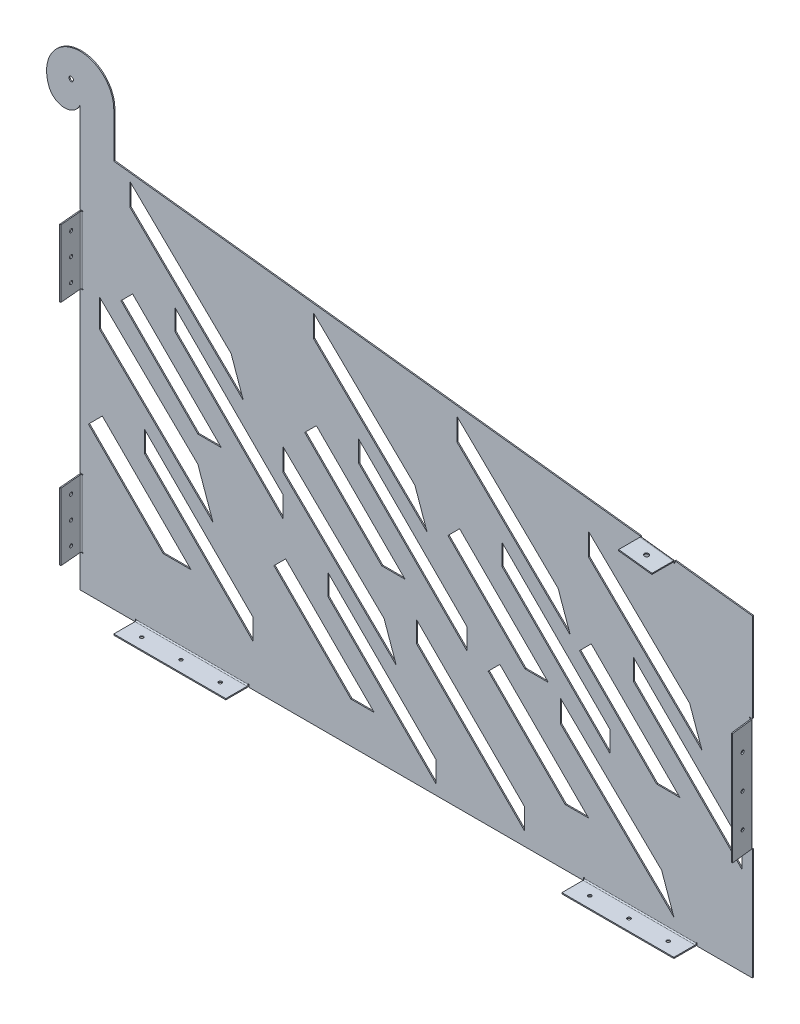
from build123d import *

# Parameters (mm, degrees)
BASE_FLANGE1_DEPTH            = 1
EDGE_FLANGE1_STRIP_W          = 6
EDGE_FLANGE1_STRIP_H          = 1
EDGE_FLANGE1_STRIP_CUT_DEPTH  = 100
EDGE_FLANGE1_RELIEF_W         = 6.5
EDGE_FLANGE1_RELIEF_H         = 0.5
EDGE_FLANGE1_RELIEF_CUT_DEPTH = 1
EDGE_FLANGE1_DEPTH            = 100
EDGE_FLANGE1_PROFILE_W        = 100
EDGE_FLANGE1_PROFILE_H        = 19
EDGE_FLANGE1_PROFILE_R        = 1.5
EDGE_FLANGE1_FLAT_DEPTH       = 1
EDGE_FLANGE2_START            = 29.5
EDGE_FLANGE2_DEPTH            = 61
EDGE_FLANGE2_2_DEPTH          = 0.5
EDGE_FLANGE2_START_2          = 90
EDGE_FLANGE2_3_DEPTH          = 0.5
EDGE_FLANGE2_START_3          = 30
EDGE_FLANGE2_4_DEPTH          = 60
EDGE_FLANGE2_5_OUTLINE_R      = 1.5
EDGE_FLANGE2_5_DEPTH          = 1
CUT_EXTRUDE12_DEPTH           = 10
CUT_EXTRUDE13_DEPTH           = 10
SKETCH44_R                    = 2
CUT_EXTRUDE14_DEPTH           = 10
EDGE_FLANGE3_START            = 99.5
EDGE_FLANGE3_DEPTH            = 101
EDGE_FLANGE3_2_DEPTH          = 0.5
EDGE_FLANGE3_START_2          = 200
EDGE_FLANGE3_3_DEPTH          = 0.5
EDGE_FLANGE3_START_3          = 100
EDGE_FLANGE3_4_DEPTH          = 100
EDGE_FLANGE3_START_4          = 595.083613355
EDGE_FLANGE3_5_OUTLINE_R      = 1.5
EDGE_FLANGE3_5_DEPTH          = 1
EDGE_FLANGE4_STRIP_W          = 6
EDGE_FLANGE4_STRIP_H          = 1
EDGE_FLANGE4_STRIP_CUT_DEPTH  = 30
EDGE_FLANGE4_RELIEF_W         = 6.5
EDGE_FLANGE4_RELIEF_H         = 0.5
EDGE_FLANGE4_RELIEF_CUT_DEPTH = 1
EDGE_FLANGE4_DEPTH            = 30
EDGE_FLANGE4_PROFILE_W        = 30
EDGE_FLANGE4_PROFILE_H        = 19
EDGE_FLANGE4_PROFILE_R        = 2
EDGE_FLANGE4_FLAT_DEPTH       = 1


with BuildPart() as part:
    # Base-Flange1: sheet metal written as solids
    # Sketch1 → Base-Flange1 (new body)
    with BuildSketch(Plane.XY):
        with BuildLine():
            Line((0, 0), (0, 350))
            Line((0, 350), (0, 375))
            ThreePointArc((0, 375), (-13.854151002, 365.75), (-27.708302005, 375))
            ThreePointArc((-27.708302005, 375), (-5.863059775, 415.921497754), (30, 386.5))
            Line((30, 386.5), (30, 346.5))
            Line((30, 346.5), (600, 280))
            Line((600, 280), (600, 0))
            Line((600, 0), (0, 0))
        make_face()
    extrude(amount=-BASE_FLANGE1_DEPTH)

    # Edge-Flange1: sheet metal written as solids
    # Edge-Flange1 strip (on a plane across the edge) → Edge-Flange1 strip cut (cut)
    with BuildSketch(Plane.YZ.offset(450)):
        with Locations((-1, -0.5)):
            Rectangle(EDGE_FLANGE1_STRIP_W, EDGE_FLANGE1_STRIP_H)
    edge_flange1_strip_cut = extrude(amount=EDGE_FLANGE1_STRIP_CUT_DEPTH, mode=Mode.SUBTRACT)

    # Edge-Flange1 relief (on the sheet) → Edge-Flange1 relief cut (cut)
    with BuildSketch(Plane(origin=(450, 2, 0), x_dir=(0, 1, 0), z_dir=(0, 0, 1))):
        with Locations((-2.75, 0.25)):
            Rectangle(EDGE_FLANGE1_RELIEF_W, EDGE_FLANGE1_RELIEF_H)
        with Locations((-2.75, -100.25)):
            Rectangle(EDGE_FLANGE1_RELIEF_W, EDGE_FLANGE1_RELIEF_H)
    edge_flange1_relief_cut = extrude(amount=-EDGE_FLANGE1_RELIEF_CUT_DEPTH, mode=Mode.SUBTRACT)

    # Edge-Flange1 bend section (on a plane across the edge) → Edge-Flange1 (add)
    with BuildSketch(Plane.YZ.offset(450)):
        with BuildLine():
            Line((0, 1), (1, 1))
            ThreePointArc((1, 1), (1.292893219, 0.292893219), (2, 0))
            Line((2, 0), (2, -1))
            ThreePointArc((2, -1), (0.585786438, -0.414213562), (0, 1))
        make_face()
    edge_flange1 = extrude(amount=EDGE_FLANGE1_DEPTH)

    # Edge-Flange1 profile (on flange) → Edge-Flange1 flat (add)
    with BuildSketch(Plane(origin=(0, 0, 0), x_dir=(-1, 0, 0), z_dir=(0, 1, 0))):
        with Locations((-500, 10.5)):
            Rectangle(EDGE_FLANGE1_PROFILE_W, EDGE_FLANGE1_PROFILE_H)
        with Locations((-535, 10)):
            Circle(EDGE_FLANGE1_PROFILE_R, mode=Mode.SUBTRACT)
        with Locations((-465, 10)):
            Circle(EDGE_FLANGE1_PROFILE_R, mode=Mode.SUBTRACT)
        with Locations((-500, 10)):
            Circle(EDGE_FLANGE1_PROFILE_R, mode=Mode.SUBTRACT)
    edge_flange1_flat = extrude(amount=EDGE_FLANGE1_FLAT_DEPTH)

    # Mirror1: Edge-Flange1 strip cut, Edge-Flange1 relief cut, Edge-Flange1, Edge-Flange1 flat across plane
    add(edge_flange1_strip_cut.mirror(Plane(origin=(300, 0, 0), x_dir=(0, 0, 1), z_dir=(1, 0, 0))), mode=Mode.SUBTRACT)
    add(edge_flange1_relief_cut.mirror(Plane(origin=(300, 0, 0), x_dir=(0, 0, 1), z_dir=(1, 0, 0))), mode=Mode.SUBTRACT)
    add(edge_flange1.mirror(Plane(origin=(300, 0, 0), x_dir=(0, 0, 1), z_dir=(1, 0, 0))))
    add(edge_flange1_flat.mirror(Plane(origin=(300, 0, 0), x_dir=(0, 0, 1), z_dir=(1, 0, 0))))

    # Edge-Flange2: read off the stored shape, not the designer's step
    # Edge-Flange2 outline → Edge-Flange2 (cut)
    with BuildSketch(Plane(origin=(0, 0, 0), x_dir=(1, 0, 0), z_dir=(0, 1, 0)).offset(EDGE_FLANGE2_START)):
        with BuildLine():
            ThreePointArc((0.363077531, 0), (1.095128339, 0.732050808), (2.095128339, 1))
            Line((2.095128339, 1), (0, 1))
            Line((0, 1), (0, 0))
            Line((0, 0), (0.363077531, 0))
        make_face()
    edge_flange2 = extrude(amount=EDGE_FLANGE2_DEPTH, mode=Mode.SUBTRACT)

    # Edge-Flange2 2 outline → Edge-Flange2 2 (cut)
    with BuildSketch(Plane(origin=(0, 0, 0), x_dir=(1, 0, 0), z_dir=(0, 1, 0)).offset(EDGE_FLANGE2_START)):
        with BuildLine():
            Line((2.595128339, 0), (2.595128339, 1))
            Line((2.595128339, 1), (2.095128339, 1))
            ThreePointArc((2.095128339, 1), (1.095128339, 0.732050808), (0.363077531, 0))
            Line((0.363077531, 0), (2.595128339, 0))
        make_face()
    edge_flange2_2 = extrude(amount=EDGE_FLANGE2_2_DEPTH, mode=Mode.SUBTRACT)

    # Edge-Flange2 3 outline → Edge-Flange2 3 (cut)
    with BuildSketch(Plane(origin=(0, 0, 0), x_dir=(1, 0, 0), z_dir=(0, 1, 0)).offset(EDGE_FLANGE2_START_2)):
        with BuildLine():
            Line((2.595128339, 0), (2.595128339, 1))
            Line((2.595128339, 1), (2.095128339, 1))
            ThreePointArc((2.095128339, 1), (1.095128339, 0.732050808), (0.363077531, 0))
            Line((0.363077531, 0), (2.595128339, 0))
        make_face()
    edge_flange2_3 = extrude(amount=EDGE_FLANGE2_3_DEPTH, mode=Mode.SUBTRACT)

    # Edge-Flange2 4 outline → Edge-Flange2 4 (add)
    with BuildSketch(Plane(origin=(0, 0, 0), x_dir=(1, 0, 0), z_dir=(0, 1, 0)).offset(EDGE_FLANGE2_START_3)):
        with BuildLine():
            ThreePointArc((1.098933641, -1.087155743), (1.357851002, -0.324409792), (2.095128339, 0))
            Line((2.095128339, 0), (0.363077531, 0))
            ThreePointArc((0.363077531, 0), (0.142536324, -0.567120772), (0.102738942, -1.174311485))
            Line((0.102738942, -1.174311485), (1.750739994, -20.011049705))
            Line((1.750739994, -20.011049705), (2.746934692, -19.923893962))
            Line((2.746934692, -19.923893962), (1.098933641, -1.087155743))
        make_face()
    edge_flange2_4 = extrude(amount=EDGE_FLANGE2_4_DEPTH)

    # Edge-Flange2 5 outline → Edge-Flange2 5 (cut)
    with BuildSketch(Plane(origin=(0, 0, 0), x_dir=(0, 1, 0), z_dir=(0.9961946980917459, 0, -0.0871557427476548))):
        with Locations((80, 10.087488664)):
            Circle(EDGE_FLANGE2_5_OUTLINE_R)
        with Locations((60, 10.087488664)):
            Circle(EDGE_FLANGE2_5_OUTLINE_R)
        with Locations((40, 10.087488664)):
            Circle(EDGE_FLANGE2_5_OUTLINE_R)
    edge_flange2_5 = extrude(amount=EDGE_FLANGE2_5_DEPTH, mode=Mode.SUBTRACT)

    # Mirror2: Edge-Flange2, Edge-Flange2 2, Edge-Flange2 3, Edge-Flange2 4, Edge-Flange2 5 across plane
    add(edge_flange2.mirror(Plane.ZX.offset(161.81)), mode=Mode.SUBTRACT)
    add(edge_flange2_2.mirror(Plane.ZX.offset(161.81)), mode=Mode.SUBTRACT)
    add(edge_flange2_3.mirror(Plane.ZX.offset(161.81)), mode=Mode.SUBTRACT)
    add(edge_flange2_4.mirror(Plane.ZX.offset(161.81)))
    add(edge_flange2_5.mirror(Plane.ZX.offset(161.81)), mode=Mode.SUBTRACT)

    # Sketch41 → Cut-Extrude12 (cut)
    with BuildSketch(Plane(origin=(0, 0, -1), x_dir=(-1, 0, 0), z_dir=(0, 0, -1))):
        Polygon((-154.141239383, 56.252516515), (-57.507077697, 152.886678201), (-57.507077697, 134.096702317), (-154.141239383, 37.462540631), align=None)
        Polygon((-17.242843662, 235.138675289), (-17.242843662, 210.263211702), (-118.574499318, 111.516547261), (-105.040256286, 149.758515319), align=None)
        Polygon((-98.945685226, 65.144201531), (-19.759358289, 144.330528468), (-9.525532138, 134.096702317), (-7.344552794, 131.915722974), (-74.116074237, 65.144201531), align=None)
        Polygon((-590.588759568, 98.27831079), (-493.954597882, 194.912472476), (-493.954597882, 176.183454114), (-590.588759568, 79.549292428), align=None)
        Polygon((-453.690363846, 272.289143861), (-453.690363846, 252.349963498), (-555.022019503, 153.603299057), (-544.151569101, 184.318531234), align=None)
        Polygon((-535.393205411, 107.230953327), (-456.206878473, 186.417280265), (-445.973052323, 176.183454114), (-445.77480592, 175.985207711), (-514.529060304, 107.230953327), align=None)
    extrude(amount=-CUT_EXTRUDE12_DEPTH, mode=Mode.SUBTRACT)

    # Sketch43 → Cut-Extrude13 (cut)
    with BuildSketch(Plane(origin=(0, 0, -1), x_dir=(-1, 0, 0), z_dir=(0, 0, -1))):
        Polygon((-125.988081756, 173.047946542), (-105.123936649, 173.047946542), (-36.369682266, 241.802200926), (-46.801754819, 252.23427348), align=None)
        Polygon((-181.183635914, 164.095304005), (-181.183635914, 145.366285643), (-84.549474228, 242.000447329), (-84.549474228, 260.729465691), align=None)
        Polygon((-134.746445446, 250.135524449), (-145.616895849, 219.420292272), (-44.285240192, 318.166956713), (-44.285240192, 338.106137076), align=None)
        Polygon((-290.064835452, 153.251364808), (-269.200690345, 153.251364808), (-200.446435962, 222.005619192), (-210.878508515, 232.437691745), align=None)
        Polygon((-345.26038961, 144.29872227), (-345.26038961, 125.569703909), (-248.626227924, 222.203865595), (-248.626227924, 240.932883956), align=None)
        Polygon((-298.823199142, 230.338942714), (-309.693649545, 199.623710538), (-208.361993888, 298.370374979), (-208.361993888, 318.309555342), align=None)
        Polygon((-262.550942194, 36.485086104), (-241.686797088, 36.485086104), (-172.932542704, 105.239340488), (-183.364615257, 115.671413041), align=None)
        Polygon((-317.746496352, 27.532443566), (-317.746496352, 8.803425205), (-221.112334666, 105.437586891), (-221.112334666, 124.166605252), align=None)
        Polygon((-271.309305885, 113.57266401), (-282.179756287, 82.857431834), (-180.84810063, 181.604096275), (-180.84810063, 201.543276638), align=None)
        Polygon((-417.903778516, 137.481206477), (-397.039633409, 137.481206477), (-328.285379025, 206.235460861), (-338.717451579, 216.667533415), align=None)
        Polygon((-473.099332674, 128.52856394), (-473.099332674, 109.799545578), (-376.465170988, 206.433707264), (-376.465170988, 225.162725626), align=None)
        Polygon((-426.662142206, 214.568784384), (-437.532592609, 183.853552207), (-336.200936952, 282.600216648), (-336.200936952, 302.539397011), align=None)
        Polygon((-453.858581835, 50.577429245), (-432.994436728, 50.577429245), (-364.240182344, 119.331683629), (-374.672254897, 129.763756183), align=None)
        Polygon((-396.804931373, 30.703925494), (-396.804931373, 11.974907133), (-300.170769687, 108.609068819), (-300.170769687, 127.33808718), align=None)
        Polygon((-519.093580354, 42.822261683), (-529.964030757, 12.107029506), (-428.6323751, 110.853693948), (-428.6323751, 130.792874311), align=None)
    extrude(amount=-CUT_EXTRUDE13_DEPTH, mode=Mode.SUBTRACT)

    # Sketch44 → Cut-Extrude14 (cut)
    with BuildSketch(Plane(origin=(0, 0, -1), x_dir=(-1, 0, 0), z_dir=(0, 0, -1))):
        with Locations((8.02, 391)):
            Circle(SKETCH44_R)
    extrude(amount=-CUT_EXTRUDE14_DEPTH, mode=Mode.SUBTRACT)

    # Edge-Flange3: read off the stored shape, not the designer's step
    # Edge-Flange3 outline → Edge-Flange3 (cut)
    with BuildSketch(Plane(origin=(0, 0, 0), x_dir=(1, 0, 0), z_dir=(0, 1, 0)).offset(EDGE_FLANGE3_START)):
        with BuildLine():
            Line((600, 1), (598.101679296, 1))
            ThreePointArc((598.101679296, 1), (599.101679296, 0.732050807), (599.833730103, 0))
            Line((599.833730103, 0), (600, 0))
            Line((600, 0), (600, 1))
        make_face()
    extrude(amount=EDGE_FLANGE3_DEPTH, mode=Mode.SUBTRACT)

    # Edge-Flange3 2 outline → Edge-Flange3 2 (cut)
    with BuildSketch(Plane(origin=(0, 0, 0), x_dir=(1, 0, 0), z_dir=(0, 1, 0)).offset(EDGE_FLANGE3_START)):
        with BuildLine():
            Line((597.601679296, 1), (597.601679296, 0))
            Line((597.601679296, 0), (599.833730103, 0))
            ThreePointArc((599.833730103, 0), (599.101679296, 0.732050807), (598.101679296, 1))
            Line((598.101679296, 1), (597.601679296, 1))
        make_face()
    extrude(amount=EDGE_FLANGE3_2_DEPTH, mode=Mode.SUBTRACT)

    # Edge-Flange3 3 outline → Edge-Flange3 3 (cut)
    with BuildSketch(Plane(origin=(0, 0, 0), x_dir=(1, 0, 0), z_dir=(0, 1, 0)).offset(EDGE_FLANGE3_START_2)):
        with BuildLine():
            Line((597.601679296, 1), (597.601679296, 0))
            Line((597.601679296, 0), (599.833730103, 0))
            ThreePointArc((599.833730103, 0), (599.101679296, 0.732050807), (598.101679296, 1))
            Line((598.101679296, 1), (597.601679296, 1))
        make_face()
    extrude(amount=EDGE_FLANGE3_3_DEPTH, mode=Mode.SUBTRACT)

    # Edge-Flange3 4 outline → Edge-Flange3 4 (add)
    with BuildSketch(Plane(origin=(0, 0, 0), x_dir=(1, 0, 0), z_dir=(0, 1, 0)).offset(EDGE_FLANGE3_START_3)):
        with BuildLine():
            Line((599.833730103, 0), (598.101679296, 0))
            ThreePointArc((598.101679296, 0), (598.767235369, -0.25365215), (599.095151985, -0.885929774))
            Line((599.095151985, -0.885929774), (601.274834315, -19.869453778))
            Line((601.274834315, -19.869453778), (602.268307003, -19.755383553))
            Line((602.268307003, -19.755383553), (600.088624674, -0.771859549))
            ThreePointArc((600.088624674, -0.771859549), (600.00080408, -0.372843678), (599.833730103, 0))
        make_face()
    extrude(amount=EDGE_FLANGE3_4_DEPTH)

    # Edge-Flange3 5 outline → Edge-Flange3 5 (cut)
    with BuildSketch(Plane(origin=(0, 0, 0), x_dir=(0, 1, 0), z_dir=(0.9934726889248264, 0, -0.11407022556511005)).offset(EDGE_FLANGE3_START_4)):
        with Locations((120, 78.32731565)):
            Circle(EDGE_FLANGE3_5_OUTLINE_R)
        with Locations((150, 78.32731565)):
            Circle(EDGE_FLANGE3_5_OUTLINE_R)
        with Locations((180, 78.32731565)):
            Circle(EDGE_FLANGE3_5_OUTLINE_R)
    extrude(amount=EDGE_FLANGE3_5_DEPTH, mode=Mode.SUBTRACT)

    # Edge-Flange4: sheet metal written as solids
    # Edge-Flange4 strip (on a plane across the edge) → Edge-Flange4 strip cut (cut)
    with BuildSketch(Plane(origin=(530.471580264, 288.111648969, 0), x_dir=(-0.11588069956017832, -0.9932631390872431, 3.4914813388431334e-15), z_dir=(-0.9932631390872431, 0.11588069956017832, 0))):
        with Locations((-1, -0.5)):
            Rectangle(EDGE_FLANGE4_STRIP_W, EDGE_FLANGE4_STRIP_H)
    extrude(amount=EDGE_FLANGE4_STRIP_CUT_DEPTH, mode=Mode.SUBTRACT)

    # Edge-Flange4 relief (on the sheet) → Edge-Flange4 relief cut (cut)
    with BuildSketch(Plane(origin=(530.239818865, 286.125122691, 0), x_dir=(-0.11588069956017832, -0.9932631390872431, 6.982962677686267e-15), z_dir=(0, 0, 1))):
        with Locations((-2.75, 0.25)):
            Rectangle(EDGE_FLANGE4_RELIEF_W, EDGE_FLANGE4_RELIEF_H)
        with Locations((-2.75, -30.25)):
            Rectangle(EDGE_FLANGE4_RELIEF_W, EDGE_FLANGE4_RELIEF_H)
    extrude(amount=-EDGE_FLANGE4_RELIEF_CUT_DEPTH, mode=Mode.SUBTRACT)

    # Edge-Flange4 bend section (on a plane across the edge) → Edge-Flange4 (add)
    with BuildSketch(Plane(origin=(530.471580264, 288.111648969, 0), x_dir=(-0.11588069956017832, -0.9932631390872431, 3.4914813388431334e-15), z_dir=(-0.9932631390872431, 0.11588069956017832, 0))):
        with BuildLine():
            Line((0, 1), (1, 1))
            ThreePointArc((1, 1), (1.292893219, 0.292893219), (2, 0))
            Line((2, 0), (2, -1))
            ThreePointArc((2, -1), (0.585786438, -0.414213562), (0, 1))
        make_face()
    extrude(amount=EDGE_FLANGE4_DEPTH)

    # Edge-Flange4 profile (on flange) → Edge-Flange4 flat (add)
    with BuildSketch(Plane(origin=(40.285009592, 345.300082214, 0), x_dir=(0.993263139087243, -0.11588069956017831, 0), z_dir=(-0.11588069956017832, -0.9932631390872431, 3.4914813388431334e-15))):
        with Locations((478.511287575, 10.5)):
            Rectangle(EDGE_FLANGE4_PROFILE_W, EDGE_FLANGE4_PROFILE_H)
        with Locations((478.511287575, 10)):
            Circle(EDGE_FLANGE4_PROFILE_R, mode=Mode.SUBTRACT)
    extrude(amount=EDGE_FLANGE4_FLAT_DEPTH)


solid = part.part
